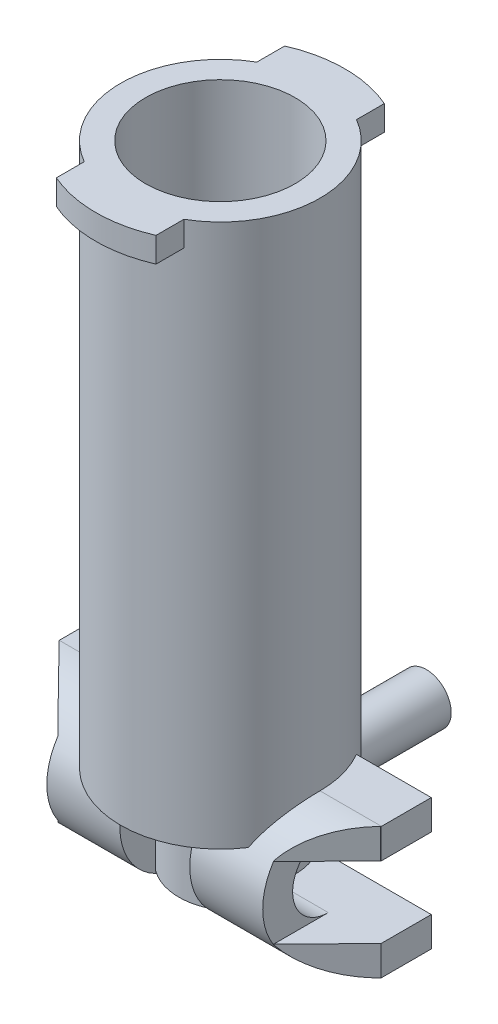
from build123d import *
from build123d.topology import SkipClean

# Parameters (mm, degrees)
SKETCH1_R            = 6
BOSS_EXTRUDE1_DEPTH  = 32.7
SHELL1_T             = -1.5
SKETCH2_R            = 3.5
BOSS_EXTRUDE3_DEPTH  = 5.5
SHELL3_START         = -4
SHELL3_OUTLINE_R     = 2
SHELL3_DEPTH         = 5.5
SKETCH4_R            = 2.5
BOSS_EXTRUDE4_DEPTH  = 6.1
SKETCH7_R            = 1.5
BOSS_EXTRUDE6_DEPTH  = 6.3
SKETCH8_R            = 0.95
CUT_EXTRUDE1_DEPTH   = 12.3
SKETCH9_R            = 2
CUT_EXTRUDE2_DEPTH   = 40.200127551
BOSS_EXTRUDE7_DEPTH  = 6.5
SKETCH11_W           = 2.1
SKETCH11_H           = 4.759411023
CUT_EXTRUDE3_DEPTH   = 41.684763873
CUT_EXTRUDE4_DEPTH   = 36.571055794
SKETCH13_W           = 4.4
SKETCH13_H           = 1.797977648
BOSS_EXTRUDE8_DEPTH  = 3
SKETCH15_W           = 4.39606385
SKETCH15_H           = 1.797977648
BOSS_EXTRUDE9_DEPTH  = 3
SKETCH16_R           = 2
CUT_EXTRUDE5_DEPTH   = 40.279765925
SKETCH17_R           = 4.5
CUT_EXTRUDE6_DEPTH   = 35.197222256
SKETCH18_W           = 3.024802645
SKETCH18_H           = 1.797977648
BOSS_EXTRUDE10_DEPTH = 3.2
BOSS_EXTRUDE11_DEPTH = 1.797977648
CUT_EXTRUDE11_DEPTH  = 38.138928519
BOSS_EXTRUDE12_DEPTH = 1.797977648
CUT_EXTRUDE12_DEPTH  = 38.138928519
BOSS_EXTRUDE13_START = -1.5
BOSS_EXTRUDE13_DEPTH = 1.5


# Read off the part's stored shape, not the designer's step: Shell3
with BuildPart() as part:
    # Sketch1 → Boss-Extrude1 (new body)
    with BuildSketch(Plane(origin=(0, 0, 0), x_dir=(1, 0, 0), z_dir=(0, 1, 0))):
        with Locations(Location((0, 0, 0), (0, 0, 270))):
            Circle(SKETCH1_R)
    extrude(amount=BOSS_EXTRUDE1_DEPTH)

    # Shell1
    shell1_openings = [part.faces().sort_by_distance(p)[0] for p in [
        (0, 32.7, 0),
    ]]
    offset(amount=SHELL1_T, openings=shell1_openings, kind=Kind.INTERSECTION)

    # Sketch2 → Boss-Extrude3 (add)
    with BuildSketch(Plane.XZ):
        with Locations(Location((0, -1, 0), (0, 0, 270))):
            Circle(SKETCH2_R)
    extrude(amount=BOSS_EXTRUDE3_DEPTH)

    # Shell3 outline → Shell3 (cut)
    with BuildSketch(Plane(origin=(0, 0, 0), x_dir=(1, 0, 0), z_dir=(0, 1, 0)).offset(SHELL3_START)):
        with Locations((0, 1)):
            Circle(SHELL3_OUTLINE_R)
    extrude(amount=SHELL3_DEPTH, mode=Mode.SUBTRACT)

    # Sketch4 → Boss-Extrude4 (add)
    with BuildSketch(Plane.XY):
        with Locations((0, -2.573540176)):
            Circle(SKETCH4_R)
    extrude(amount=-BOSS_EXTRUDE4_DEPTH)

    # Sketch7 → Boss-Extrude6 (add)
    with BuildSketch(Plane(origin=(0, 0, -6.1), x_dir=(-1, 0, 0), z_dir=(0, 0, -1))):
        with Locations((0, -2.573540176)):
            Circle(SKETCH7_R)
    extrude(amount=BOSS_EXTRUDE6_DEPTH)

    # Sketch8 → Cut-Extrude1 (cut)
    with BuildSketch(Plane(origin=(0, 0, -12.4), x_dir=(-1, 0, 0), z_dir=(0, 0, -1))):
        with Locations((0, -2.573540176)):
            Circle(SKETCH8_R)
    extrude(amount=-CUT_EXTRUDE1_DEPTH, mode=Mode.SUBTRACT)

    # Sketch9 → Cut-Extrude2 (cut, through all)
    with BuildSketch(Plane(origin=(0, -4, 0), x_dir=(1, 0, 0), z_dir=(0, 1, 0))):
        with Locations(Location((0, 1, 0), (0, 0, 270))):
            Circle(SKETCH9_R)
    extrude(amount=CUT_EXTRUDE2_DEPTH, mode=Mode.SUBTRACT)

    # Sketch10 → Boss-Extrude7 (add)
    with BuildSketch(Plane(origin=(0, 0, 0), x_dir=(0, 0, -1), z_dir=(1, 0, 0))):
        with BuildLine():
            Line((0, -4.3), (0, -6.097977648))
            ThreePointArc((0, -6.097977648), (-3.947977648, -2.15), (0, 1.797977648))
            Line((0, 1.797977648), (0, 0))
            ThreePointArc((0, 0), (-2.15, -2.15), (0, -4.3))
        make_face()
    extrude(amount=BOSS_EXTRUDE7_DEPTH)

    # Sketch11 → Cut-Extrude3 (cut, through all)
    with BuildSketch(Plane.XZ.offset(5.5)):
        with Locations((1.05, 2.379705512)):
            Rectangle(SKETCH11_W, SKETCH11_H)
    extrude(amount=CUT_EXTRUDE3_DEPTH, mode=Mode.SUBTRACT)

    # Sketch12 → Cut-Extrude4 (cut, through all)
    with BuildSketch(Plane.XZ):
        with BuildLine():
            Line((2.105734518, 1.795689922), (2.105734518, 3.947977648))
            Line((2.105734518, 3.947977648), (0, 3.947977648))
            Line((0, 3.947977648), (0, 2.5))
            ThreePointArc((0, 2.5), (1.110199368, 2.319255544), (2.105734518, 1.795689922))
        make_face()
    extrude(amount=CUT_EXTRUDE4_DEPTH, mode=Mode.SUBTRACT)

    # Sketch13 → Boss-Extrude8 (add)
    with BuildSketch(Plane(origin=(0, 0, 0), x_dir=(-1, 0, 0), z_dir=(0, 0, -1))):
        with Locations((-4.3, -5.198988824)):
            Rectangle(SKETCH13_W, SKETCH13_H)
    extrude(amount=BOSS_EXTRUDE8_DEPTH)

    # Sketch15 → Boss-Extrude9 (add)
    with SkipClean():  # the faces are left unmerged after this step: merging them gives an invalid solid
        with BuildSketch(Plane(origin=(0, 0, 0), x_dir=(-1, 0, 0), z_dir=(0, 0, -1))):
            with Locations((-4.301968075, 0.898988824)):
                Rectangle(SKETCH15_W, SKETCH15_H)
        extrude(amount=BOSS_EXTRUDE9_DEPTH)

    # Sketch16 → Cut-Extrude5 (cut, through all)
    with SkipClean():  # the faces are left unmerged after this step: merging them gives an invalid solid
        with BuildSketch(Plane(origin=(0, -4, 0), x_dir=(1, 0, 0), z_dir=(0, 1, 0))):
            with Locations(Location((0, 1, 0), (0, 0, 270))):
                Circle(SKETCH16_R)
        extrude(amount=CUT_EXTRUDE5_DEPTH, mode=Mode.SUBTRACT)

    # Sketch17 → Cut-Extrude6 (cut, through all)
    with SkipClean():  # the faces are left unmerged after this step: merging them gives an invalid solid
        with BuildSketch(Plane(origin=(0, 1.5, 0), x_dir=(1, 0, 0), z_dir=(0, 1, 0))):
            with Locations(Location((0, 0, 0), (0, 0, 270))):
                Circle(SKETCH17_R)
        extrude(amount=CUT_EXTRUDE6_DEPTH, mode=Mode.SUBTRACT)

    # Sketch18 → Boss-Extrude10 (add)
    with SkipClean():  # the faces are left unmerged after this step: merging them gives an invalid solid
        with BuildSketch(Plane(origin=(6.5, 0, 0), x_dir=(0, 0, -1), z_dir=(1, 0, 0))):
            with Locations((1.487598678, 0.898988824)):
                Rectangle(SKETCH18_W, SKETCH18_H)
            with Locations((1.487598678, -5.198988824)):
                Rectangle(SKETCH18_W, SKETCH18_H)
        extrude(amount=BOSS_EXTRUDE10_DEPTH)

    # Sketch19 → Boss-Extrude11 (add)
    with SkipClean():  # the faces are left unmerged after this step: merging them gives an invalid solid
        with BuildSketch(Plane(origin=(0, -4.3, 0), x_dir=(1, 0, 0), z_dir=(0, 1, 0))):
            Polygon((6.5, -3.285642739), (6.5, 0), (9.7, -0.024802645), align=None)
        extrude(amount=-BOSS_EXTRUDE11_DEPTH)

    # Sketch22 → Cut-Extrude11 (cut, through all)
    with SkipClean():  # the faces are left unmerged after this step: merging them gives an invalid solid
        with BuildSketch(Plane.ZY.offset(-6.5)):
            with BuildLine():
                Line((0, -6.097977648), (3.285642739, -6.097977648))
                Line((3.285642739, -6.097977648), (3.285642739, -4.33885342))
                ThreePointArc((3.285642739, -4.33885342), (1.863462252, -5.630522366), (0, -6.097977648))
            make_face()
        extrude(amount=-CUT_EXTRUDE11_DEPTH, mode=Mode.SUBTRACT)

    # Sketch24 → Boss-Extrude12 (add)
    with SkipClean():  # the faces are left unmerged after this step: merging them gives an invalid solid
        with BuildSketch(Plane.XZ):
            Polygon((9.7, 0), (6.5, 3.285642739), (6.5, 0.012401323), align=None)
        extrude(amount=-BOSS_EXTRUDE12_DEPTH)

    # Sketch25 → Cut-Extrude12 (cut, through all)
    with SkipClean():  # the faces are left unmerged after this step: merging them gives an invalid solid
        with BuildSketch(Plane.ZY.offset(-6.5)):
            with BuildLine():
                Line((3.285642739, 0.03885342), (3.285642739, 1.797977648))
                Line((3.285642739, 1.797977648), (0, 1.797977648))
                ThreePointArc((0, 1.797977648), (1.863462252, 1.330522366), (3.285642739, 0.03885342))
            make_face()
        extrude(amount=-CUT_EXTRUDE12_DEPTH, mode=Mode.SUBTRACT)

    # Mirror3: part across plane


with BuildPart() as part_1:
    add(part.part)
    add(part.part.mirror(Plane(origin=(0, 0, 0), x_dir=(0, 0, 1), z_dir=(1, 0, 0))))

    # Sketch26 → Boss-Extrude13 (add)
    with SkipClean():  # the faces are left unmerged after this step: merging them gives an invalid solid
        with BuildSketch(Plane(origin=(0, 32.7, 0), x_dir=(1, 0, 0), z_dir=(0, 1, 0)).offset(BOSS_EXTRUDE13_START)):
            with BuildLine():
                Line((3, 5.196152423), (3, 6.873863542))
                ThreePointArc((3, 6.873863542), (0, 7.5), (-3, 6.873863542))
                Line((-3, 6.873863542), (-3, 5.196152423))
                ThreePointArc((-3, 5.196152423), (0, 6), (3, 5.196152423))
            make_face()
            with BuildLine():
                Line((3, -5.196152423), (3, -6.873863542))
                ThreePointArc((3, -6.873863542), (0, -7.5), (-3, -6.873863542))
                Line((-3, -6.873863542), (-3, -5.196152423))
                ThreePointArc((-3, -5.196152423), (0, -6), (3, -5.196152423))
            make_face()
        extrude(amount=BOSS_EXTRUDE13_DEPTH)


solid = part_1.part
